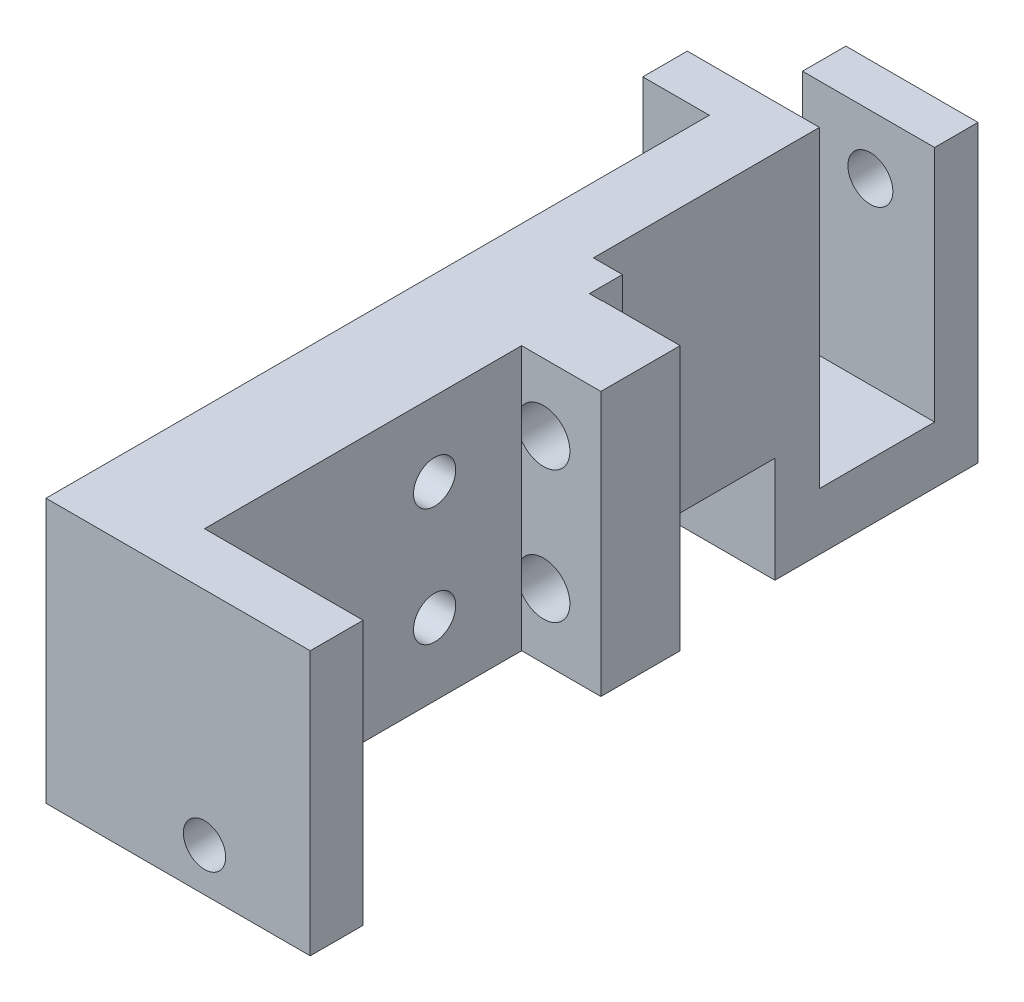
from build123d import *

# Parameters (mm, degrees)
BOSS_EXTRUDE1_DEPTH      = 20
CUT_EXTRUDE1_DEPTH       = 20
SKETCH3_W                = 42.504801082
SKETCH3_H                = 61.271071749
CUT_EXTRUDE2_DEPTH       = 7
BOSS_EXTRUDE3_DEPTH      = 8
BOSS_EXTRUDE3_DEPTH_BACK = 20
SKETCH5_W                = 10
SKETCH5_H                = 3.373015501
SKETCH6_R                = 2
CUT_EXTRUDE3_DEPTH       = 6
SKETCH7_W                = 10
SKETCH7_H                = 4.325701587
BOSS_EXTRUDE4_DEPTH      = 12
SKETCH8_W                = 10
SKETCH8_H                = 3.285099304
BOSS_EXTRUDE5_DEPTH      = 18
SKETCH9_R                = 1.7
CUT_EXTRUDE4_DEPTH       = 20
SKETCH10_W               = 4.6581603
SKETCH10_H               = 5.7
CUT_EXTRUDE5_DEPTH       = 3
SKETCH12_R               = 1.6
CUT_EXTRUDE7_DEPTH       = 5
SKETCH13_R               = 1.6
CUT_EXTRUDE8_DEPTH       = 12


with BuildPart() as part:
    # Sketch1 → Boss-Extrude1 (new body)
    with BuildSketch(Plane(origin=(0, 0, 0), x_dir=(1, 0, 0), z_dir=(0, 1, 0))):
        Polygon((8, 0), (0, 0), (0, -60.58), (20, -60.58), (20, -56.58), (8, -56.58), (8, -32.58), (14, -32.58), (14, -26.58), (8, -26.58), align=None)
    extrude(amount=BOSS_EXTRUDE1_DEPTH)

    # Sketch2 → Cut-Extrude1 (cut)
    with BuildSketch(Plane(origin=(0, 0, 0), x_dir=(-1, 0, 0), z_dir=(0, -1, 0))):
        Polygon((-8, 0), (-8, -26.58), (-8.155800491, -26.58), (-8.155800491, -26.605830214), (-7.155800491, -26.605830214), (-7.155800491, -24.105830214), (-4.963777836, -24.105830214), (-4.963777836, 0), align=None)
    extrude(amount=-CUT_EXTRUDE1_DEPTH, mode=Mode.SUBTRACT)

    # Sketch3 → Cut-Extrude2 (cut)
    with BuildSketch(Plane(origin=(0, 0, 0), x_dir=(-1, 0, 0), z_dir=(0, 0, -1))):
        with Locations((-1.640387793, 8.242348963)):
            Rectangle(SKETCH3_W, SKETCH3_H)
    extrude(amount=-CUT_EXTRUDE2_DEPTH, mode=Mode.SUBTRACT)

    # Sketch5 → Boss-Extrude3 (add, two sides: drawn at the far end of the back side and taken through both)
    with BuildSketch(Plane(origin=(0, 0, 0), x_dir=(-1, 0, 0), z_dir=(0, -1, 0)).offset(-BOSS_EXTRUDE3_DEPTH_BACK)):
        with Locations((0.036222164, -8.686507751)):
            Rectangle(SKETCH5_W, SKETCH5_H)
    extrude(amount=BOSS_EXTRUDE3_DEPTH + BOSS_EXTRUDE3_DEPTH_BACK)

    # Sketch6 → Cut-Extrude3 (cut)
    with BuildSketch(Plane(origin=(0, 0, 26.58), x_dir=(-1, 0, 0), z_dir=(0, 0, -1))):
        with Locations((-9.655800491, 4.904630263)):
            Circle(SKETCH6_R)
        with Locations((-9.655800491, 14.904630263)):
            Circle(SKETCH6_R)
    extrude(amount=-CUT_EXTRUDE3_DEPTH, mode=Mode.SUBTRACT)

    # Sketch7 → Boss-Extrude4 (add)
    with BuildSketch(Plane(origin=(0, 0, 7), x_dir=(-1, 0, 0), z_dir=(0, 0, -1))):
        with Locations((0.036222164, -5.837149207)):
            Rectangle(SKETCH7_W, SKETCH7_H)
    extrude(amount=BOSS_EXTRUDE4_DEPTH)

    # Sketch8 → Boss-Extrude5 (add)
    with BuildSketch(Plane(origin=(0, -3.674298413, 0), x_dir=(1, 0, 0), z_dir=(0, 1, 0))):
        with Locations((-0.036222164, 3.357450348)):
            Rectangle(SKETCH8_W, SKETCH8_H)
    extrude(amount=BOSS_EXTRUDE5_DEPTH)

    # Sketch9 → Cut-Extrude4 (cut)
    with BuildSketch(Plane(origin=(0, 0, -5), x_dir=(-1, 0, 0), z_dir=(0, 0, -1))):
        with Locations((-0.102745826, 9.860584284)):
            Circle(SKETCH9_R)
    extrude(amount=-CUT_EXTRUDE4_DEPTH, mode=Mode.SUBTRACT)

    # Sketch10 → Cut-Extrude5 (cut)
    with BuildSketch(Plane.ZY):
        with Locations((12.702095651, 9.85)):
            Rectangle(SKETCH10_W, SKETCH10_H)
    extrude(amount=-CUT_EXTRUDE5_DEPTH, mode=Mode.SUBTRACT)

    # Sketch12 → Cut-Extrude7 (cut)
    with BuildSketch(Plane.XY.offset(60.58)):
        with Locations((12, 3.26546718)):
            Circle(SKETCH12_R)
    extrude(amount=-CUT_EXTRUDE7_DEPTH, mode=Mode.SUBTRACT)

    # Sketch13 → Cut-Extrude8 (cut)
    with BuildSketch(Plane.ZY):
        with Locations((39.167156573, 5.468808009)):
            Circle(SKETCH13_R)
        with Locations((39.167156573, 14.370824603)):
            Circle(SKETCH13_R)
    extrude(amount=-CUT_EXTRUDE8_DEPTH, mode=Mode.SUBTRACT)


solid = part.part
